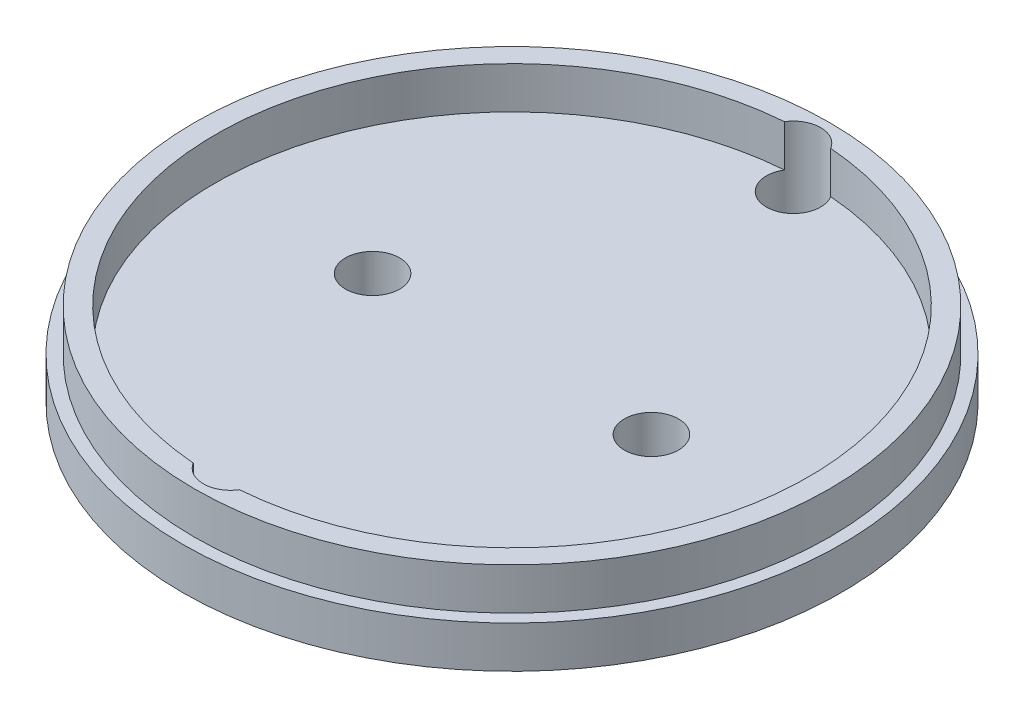
from build123d import *

# Parameters (mm, degrees)
SKETCH1_R               = 37.95
SKETCH1_R_2             = 35.45
BOSS_EXTRUDE1_DEPTH     = 5
SKETCH1_4_R             = 39.4
BOSS_EXTRUDE2_DEPTH     = 5
CUT_EXTRUDE1_DEPTH      = 57.610246422
CUT_EXTRUDE1_DEPTH_BACK = 57.610246422
SKETCH4_R               = 3.2385


with BuildPart() as part:
    # Sketch1 → Boss-Extrude1 (new body)
    with BuildSketch(Plane(origin=(0, 0, 0), x_dir=(1, 0, 0), z_dir=(0, 1, 0))):
        Circle(SKETCH1_R)
        Circle(SKETCH1_R_2, mode=Mode.SUBTRACT)
    extrude(amount=BOSS_EXTRUDE1_DEPTH)

    # Sketch1<4> → Boss-Extrude2 (add)
    with BuildSketch(Plane(origin=(0, 0, 0), x_dir=(1, 0, 0), z_dir=(0, 1, 0))):
        Circle(SKETCH1_4_R)
    extrude(amount=-BOSS_EXTRUDE2_DEPTH)

    # Sketch4 → Cut-Extrude1 (cut, two sides: drawn at the far end of the back side and taken through both)
    with BuildSketch(Plane.XZ.offset(5).offset(-CUT_EXTRUDE1_DEPTH_BACK)):
        with Locations((-16.66875, 0)):
            Circle(SKETCH4_R)
        with Locations((16.66875, 0)):
            Circle(SKETCH4_R)
        with Locations((0, 33.655)):
            Circle(SKETCH4_R)
        with Locations((0, -33.655)):
            Circle(SKETCH4_R)
    extrude(amount=CUT_EXTRUDE1_DEPTH + CUT_EXTRUDE1_DEPTH_BACK, mode=Mode.SUBTRACT)


solid = part.part
